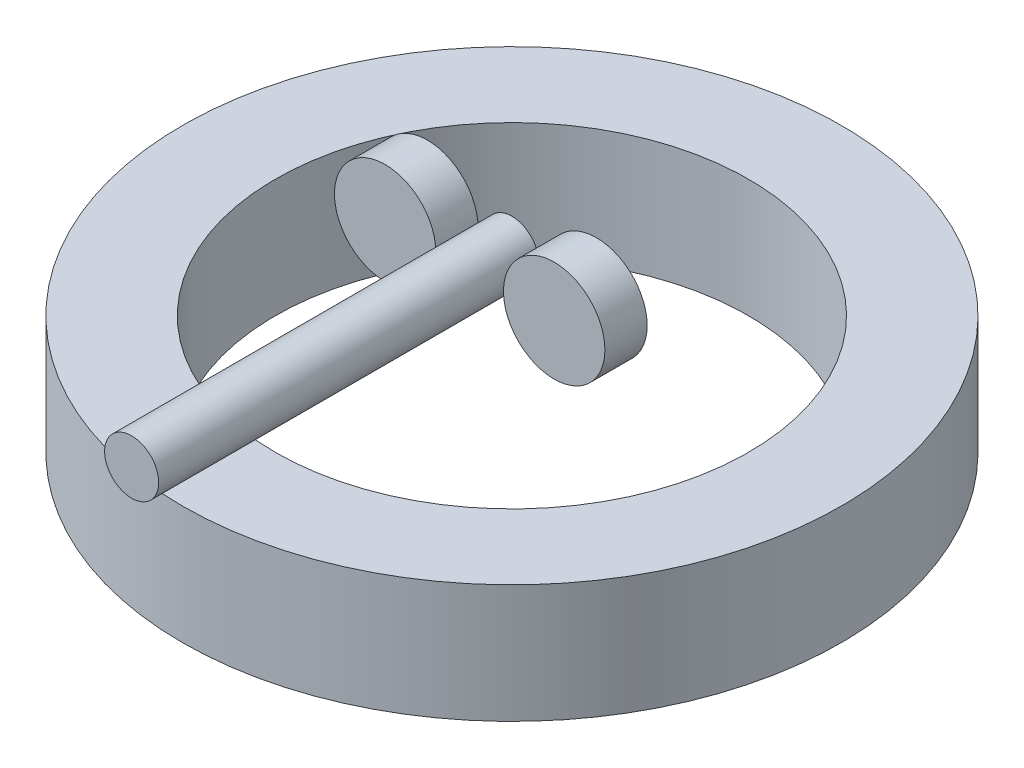
from build123d import *

# Parameters (mm, degrees)
SKETCH1_R             = 9750
SKETCH1_R_2           = 7000
BOSS_EXTRUDE1_DEPTH   = 3500
SKETCH2_R             = 800
BOSS_EXTRUDE2_DEPTH   = 11250
SKETCH4_R             = 1500
BOSS_EXTRUDE4_DEPTH   = 1250
BOSS_EXTRUDE4_2_DEPTH = 1250


with BuildPart() as part:
    # Sketch1 → Boss-Extrude1 (new body)
    with BuildSketch(Plane(origin=(0, 0, 0), x_dir=(1, 0, 0), z_dir=(0, 1, 0))):
        Circle(SKETCH1_R)
        Circle(SKETCH1_R_2, mode=Mode.SUBTRACT)
    extrude(amount=-BOSS_EXTRUDE1_DEPTH)


with BuildPart() as body_2:
    # Sketch2 → Boss-Extrude2 (new body)
    with BuildSketch(Plane.XY):
        with Locations((0, 1750)):
            Circle(SKETCH2_R)
    extrude(amount=BOSS_EXTRUDE2_DEPTH)


with BuildPart() as body_3:
    # Sketch4 → Boss-Extrude4 (new body)
    with BuildSketch(Plane.XY):
        with Locations((-2500, 1750)):
            Circle(SKETCH4_R)
    extrude(amount=BOSS_EXTRUDE4_DEPTH)


with BuildPart() as body_4:
    # Sketch4 → Boss-Extrude4 2 (new body)
    with BuildSketch(Plane.XY):
        with Locations((2500, 1750)):
            Circle(SKETCH4_R)
    extrude(amount=BOSS_EXTRUDE4_2_DEPTH)


solid = Compound([part.part, body_2.part, body_3.part, body_4.part])
